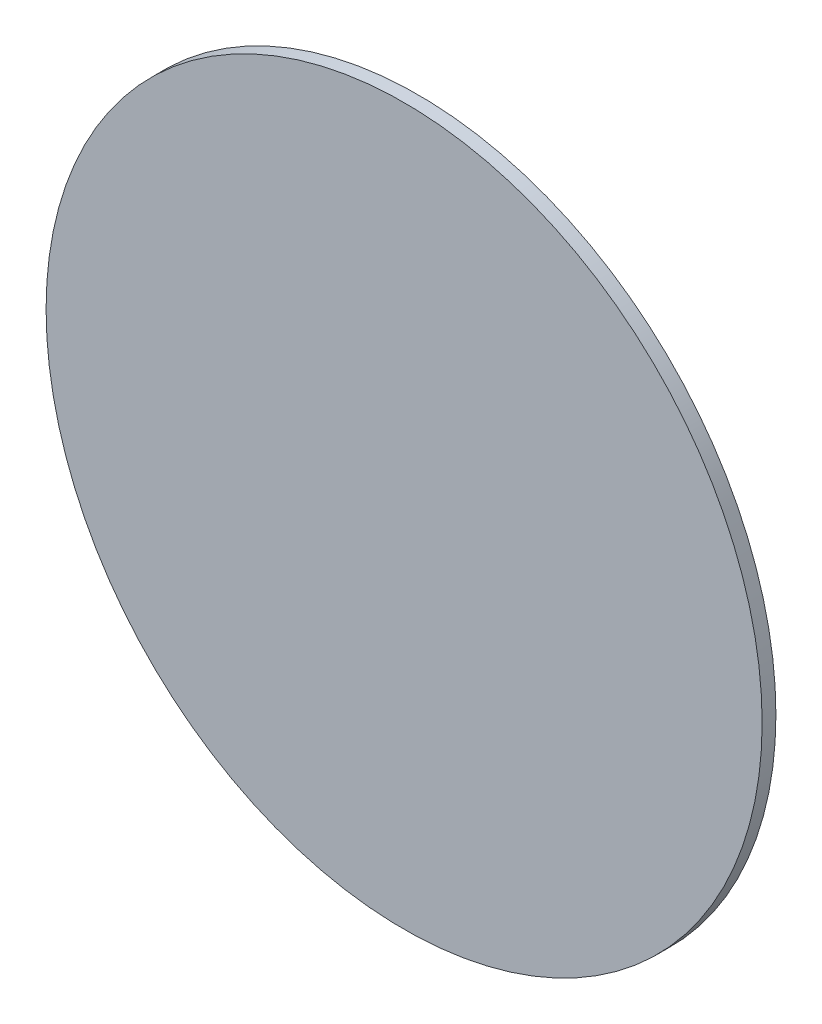
from build123d import *

# Parameters (mm, degrees)
SKETCH1_R           = 165.1
BOSS_EXTRUDE1_DEPTH = 3.175


with BuildPart() as part:
    # Sketch1 → Boss-Extrude1 (new, symmetric)
    with BuildSketch(Plane.XY):
        Circle(SKETCH1_R)
    extrude(amount=BOSS_EXTRUDE1_DEPTH, both=True)


solid = part.part
